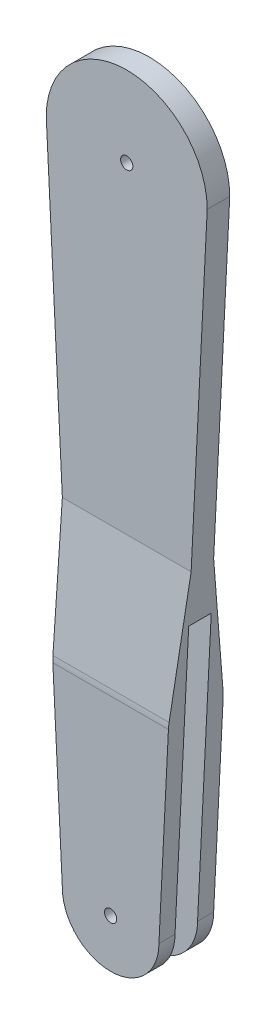
from build123d import *

# Parameters (mm, degrees)
BOSS_EXTRUDE1_DEPTH  = 7
SKETCH6_R            = 2.25
CUT_EXTRUDE4_DEPTH   = 25
BOSS_EXTRUDE2_START  = -21
BOSS_EXTRUDE2_DEPTH  = 43
CUT_EXTRUDE5_DEPTH   = 28
FILLET1_R            = 15
FILLET1_OF_MIRROR1_R = 15
SKETCH12_W           = 7
SKETCH12_H           = 100
CUT_EXTRUDE6_DEPTH   = 24.5
SKETCH13_R           = 1.9
CUT_EXTRUDE7_DEPTH   = 24.5
SKETCH14_R           = 1.9
CUT_EXTRUDE8_DEPTH   = 7


with BuildPart() as part:
    # Sketch2 → Boss-Extrude1 (new body)
    with BuildSketch(Plane.XY):
        with BuildLine():
            ThreePointArc((0, -215), (10.606601718, -210.606601718), (15, -200))
            Line((15, -200), (25, 0))
            ThreePointArc((25, 0), (0, 25), (-25, 0))
            Line((-25, 0), (-15, -200))
            ThreePointArc((-15, -200), (-10.606601718, -210.606601718), (0, -215))
        make_face()
    extrude(amount=BOSS_EXTRUDE1_DEPTH)

    # Sketch6 → Cut-Extrude4 (cut)
    with BuildSketch(Plane.XY.offset(7)):
        with Locations((0, -200)):
            Circle(SKETCH6_R)
    extrude(amount=-CUT_EXTRUDE4_DEPTH, mode=Mode.SUBTRACT)

    # Sketch9 → Boss-Extrude2 (add)
    with BuildSketch(Plane.ZY.offset(BOSS_EXTRUDE2_START)):
        Polygon((0, -200), (0, -215), (-5, -215), (-5, -140), (0, -100), align=None)
    boss_extrude2 = extrude(amount=BOSS_EXTRUDE2_DEPTH)

    # Sketch10 → Cut-Extrude5 (cut, symmetric)
    with BuildSketch(Plane.XY.offset(7)):
        with BuildLine():
            Line((-22, -215), (1.38e-07, -215))
            ThreePointArc((1.38e-07, -215), (-10.606601669, -210.606601767), (-15, -200))
            Line((-15, -200), (-20, -100))
            Line((-20, -100), (-22, -100))
            Line((-22, -100), (-22, -215))
        make_face()
        with BuildLine():
            Line((21, -100), (20, -100))
            Line((20, -100), (15, -200))
            ThreePointArc((15, -200), (10.606601767, -210.606601669), (1.38e-07, -215))
            Line((1.38e-07, -215), (21, -215))
            Line((21, -215), (21, -100))
        make_face()
    cut_extrude5 = extrude(amount=CUT_EXTRUDE5_DEPTH, both=True, mode=Mode.SUBTRACT)

    # Fillet1
    fillet1_edges = [part.edges().sort_by_distance(p)[0] for p in [
        (0, -140, -5),
    ]]
    fillet(fillet1_edges, radius=FILLET1_R)

    # Mirror1: Boss-Extrude2 across plane
    add(boss_extrude2.mirror(Plane.XY.offset(3.5)))

    # Fillet1 of Mirror1
    fillet1_of_mirror1_edges = [part.edges().sort_by_distance(p)[0] for p in [
        (0, -140, 12),
    ]]
    fillet(fillet1_of_mirror1_edges, radius=FILLET1_OF_MIRROR1_R)

    # Mirror2: Cut-Extrude5 across plane
    add(cut_extrude5.mirror(Plane.XY.offset(3.5)), mode=Mode.SUBTRACT)

    # Sketch12 → Cut-Extrude6 (cut, symmetric)
    with BuildSketch(Plane.ZY):
        with Locations((3.5, -165)):
            Rectangle(SKETCH12_W, SKETCH12_H)
    extrude(amount=CUT_EXTRUDE6_DEPTH, both=True, mode=Mode.SUBTRACT)

    # Sketch13 → Cut-Extrude7 (cut, symmetric)
    with BuildSketch(Plane(origin=(0, 0, -5), x_dir=(-1, 0, 0), z_dir=(0, 0, -1))):
        with Locations((0, -200)):
            Circle(SKETCH13_R)
    extrude(amount=CUT_EXTRUDE7_DEPTH, both=True, mode=Mode.SUBTRACT)

    # Sketch14 → Cut-Extrude8 (cut)
    with BuildSketch(Plane(origin=(0, 0, 0), x_dir=(-1, 0, 0), z_dir=(0, 0, -1))):
        Circle(SKETCH14_R)
    extrude(amount=-CUT_EXTRUDE8_DEPTH, mode=Mode.SUBTRACT)


solid = part.part
